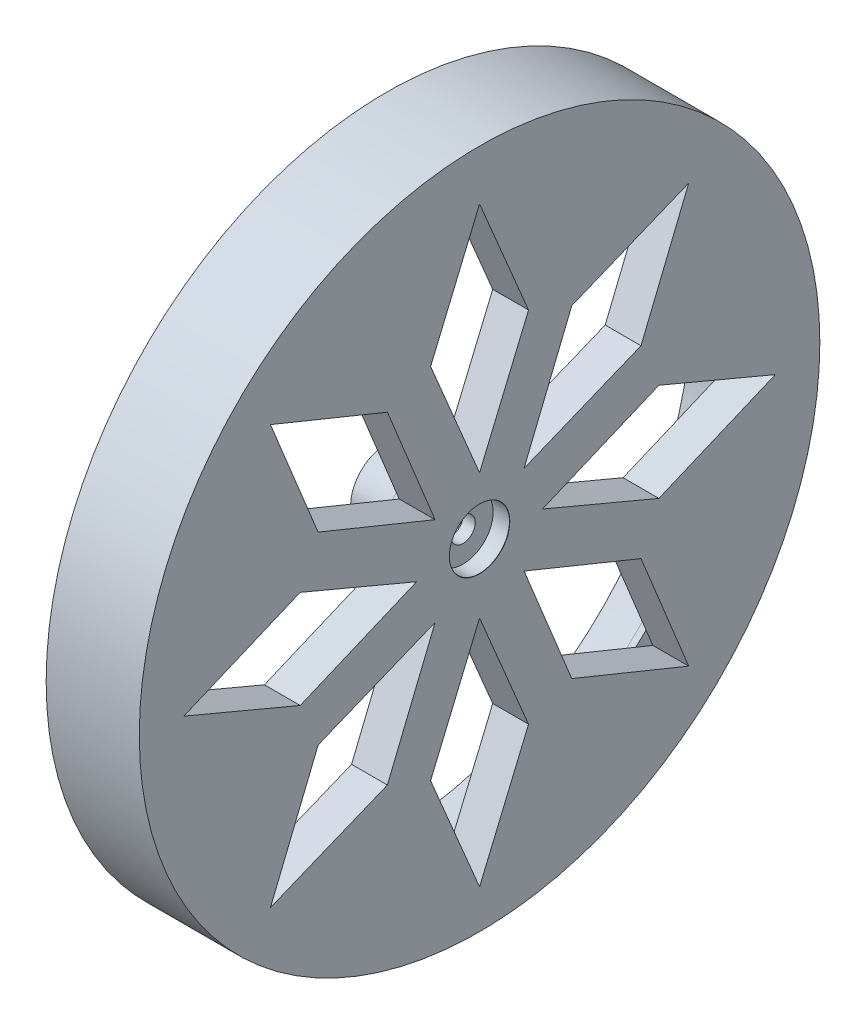
from build123d import *

# Parameters (mm, degrees)
SKETCH2_R           = 47.5
BOSS_EXTRUDE1_DEPTH = 13
SKETCH2_4_R         = 42.5
SKETCH2_4_R_2       = 5
CUT_EXTRUDE1_DEPTH  = 8
CUT_EXTRUDE2_DEPTH  = 9
FILLET1_R           = 3
FILLET2_R           = 3
CUT_EXTRUDE4_DEPTH  = 5
CIRPATTERN1_COUNT   = 8


# Read off the part's stored shape, not the designer's step: CBORE for M3 Hex Head Machine Screw1
with BuildPart() as part:
    # Sketch2 → Boss-Extrude1 (new body)
    with BuildSketch(Plane(origin=(0, 0, 0), x_dir=(0, 0, -1), z_dir=(1, 0, 0))):
        with Locations(Location((0, 0, 0), (0, 0, 180))):
            Circle(SKETCH2_R)
    extrude(amount=BOSS_EXTRUDE1_DEPTH)

    # Sketch2<4> → Cut-Extrude1 (cut)
    with BuildSketch(Plane(origin=(0, 0, 0), x_dir=(0, 0, -1), z_dir=(1, 0, 0))):
        Circle(SKETCH2_4_R)
        Circle(SKETCH2_4_R_2, mode=Mode.SUBTRACT)
    extrude(amount=CUT_EXTRUDE1_DEPTH, mode=Mode.SUBTRACT)

    # Sketch2<5> → Cut-Extrude2 (cut)
    with BuildSketch(Plane(origin=(0, 0, 0), x_dir=(0, 0, -1), z_dir=(1, 0, 0))):
        with BuildLine():
            ThreePointArc((1.375, 1.452368755), (0, 2), (-1.375, 1.452368755))
            Line((-1.375, 1.452368755), (-1.375, -1.452368755))
            ThreePointArc((-1.375, -1.452368755), (0, -2), (1.375, -1.452368755))
            Line((1.375, -1.452368755), (1.375, 1.452368755))
        make_face()
    extrude(amount=CUT_EXTRUDE2_DEPTH, mode=Mode.SUBTRACT)

    # Fillet1
    fillet1_edges = [part.edges().sort_by_distance(p)[0] for p in [
        (8, 0, 5),
    ]]
    fillet(fillet1_edges, radius=FILLET1_R)

    # Fillet2
    fillet2_edges = [part.edges().sort_by_distance(p)[0] for p in [
        (8, 0, 42.5),
    ]]
    fillet(fillet2_edges, radius=FILLET2_R)

    # Sketch4 → Cut-Extrude4 (cut)
    with BuildSketch(Plane(origin=(13, 0, 0), x_dir=(0, 0, -1), z_dir=(1, 0, 0))):
        Polygon((0, 8), (6.83592916, 24.25), (0, 40.5), (-6.83592916, 24.25), align=None)
    cut_extrude4 = extrude(amount=-CUT_EXTRUDE4_DEPTH, mode=Mode.SUBTRACT)

    # CirPattern1: Cut-Extrude4 ×8 about axis
    cirpattern1_axis = Axis((0, -0.784667472, 0), (1, 0, 0))
    for i in range(1, CIRPATTERN1_COUNT):
        add(cut_extrude4.rotate(cirpattern1_axis, i * 360 / CIRPATTERN1_COUNT), mode=Mode.SUBTRACT)

    # CBORE for M3 Hex Head Machine Screw1 out → CBORE for M3 Hex Head Machine Screw1 (revolve, cut)
    with BuildSketch(Plane.YX):
        Polygon((0, 9), (1.7, 9), (1.7, 10.7), (4.2, 10.7), (4.2, 12.975), (4.225, 13), (0, 13), align=None)
    revolve(axis=Axis((0, 0, 0), (1, 0, 0)), mode=Mode.SUBTRACT)


solid = part.part
